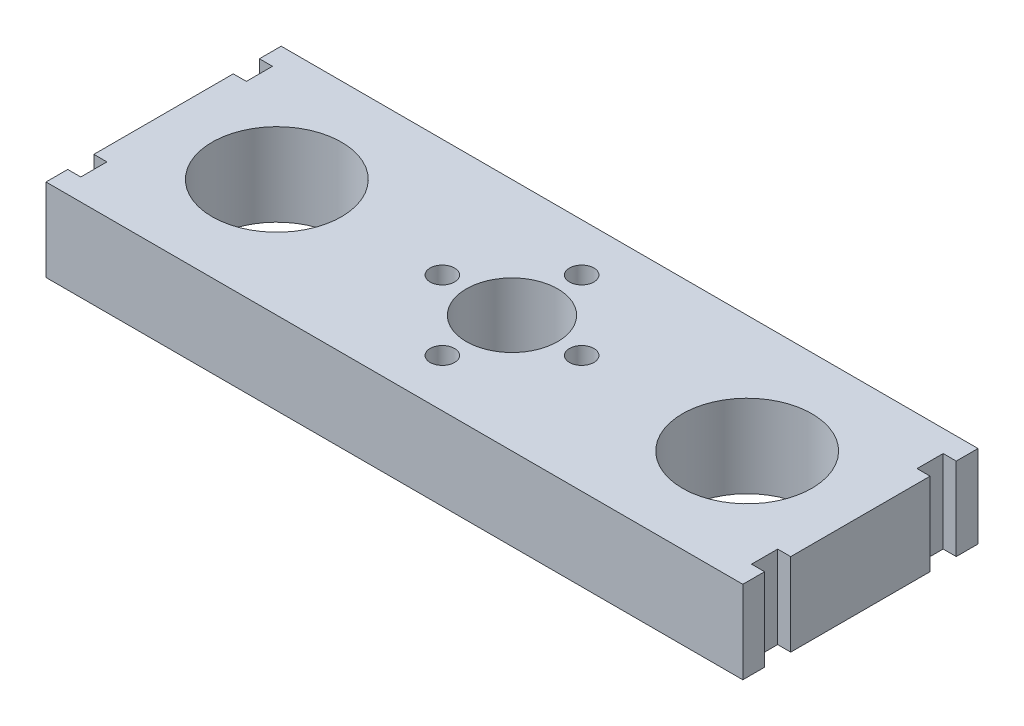
from build123d import *

# Parameters (mm, degrees)
SKETCH_1_W          = 80
SKETCH_1_H          = 27
EXTRUDE_1_DEPTH     = 9.5
SKETCH_3_R          = 7.425
CUT_EXTRUDE_1_DEPTH = 44.272393047
SKETCH_4_R          = 5.25
CUT_EXTRUDE_2_DEPTH = 44.272393047
SKETCH_5_R          = 1.4
CUT_EXTRUDE_3_DEPTH = 44.272393047
SKETCH_7_W          = 1.5
SKETCH_7_H          = 3
CUT_EXTRUDE_4_DEPTH = 44.272393047


with BuildPart() as part:
    # 草图1 → 凸台-拉伸1 (new body)
    with BuildSketch(Plane(origin=(0, 0, 0), x_dir=(1, 0, 0), z_dir=(0, 1, 0))):
        Rectangle(SKETCH_1_W, SKETCH_1_H)
    extrude(amount=EXTRUDE_1_DEPTH)

    # 草图3 → 切除-拉伸1 (cut, through all)
    with BuildSketch(Plane(origin=(0, 9.5, 0), x_dir=(1, 0, 0), z_dir=(0, 1, 0))):
        with Locations((-27, 0)):
            Circle(SKETCH_3_R)
        with Locations((27, 0)):
            Circle(SKETCH_3_R)
    extrude(amount=-CUT_EXTRUDE_1_DEPTH, mode=Mode.SUBTRACT)

    # 草图4 → 切除-拉伸2 (cut, through all)
    with BuildSketch(Plane(origin=(0, 9.5, 0), x_dir=(1, 0, 0), z_dir=(0, 1, 0))):
        Circle(SKETCH_4_R)
    extrude(amount=-CUT_EXTRUDE_2_DEPTH, mode=Mode.SUBTRACT)

    # 草图5 → 切除-拉伸3 (cut, through all)
    with BuildSketch(Plane(origin=(0, 9.5, 0), x_dir=(1, 0, 0), z_dir=(0, 1, 0))):
        with Locations((8, 0)):
            Circle(SKETCH_5_R)
        with Locations((-8, 0)):
            Circle(SKETCH_5_R)
        with Locations((0, 8)):
            Circle(SKETCH_5_R)
        with Locations((0, -8)):
            Circle(SKETCH_5_R)
    extrude(amount=-CUT_EXTRUDE_3_DEPTH, mode=Mode.SUBTRACT)

    # 草图7 → 切除-拉伸4 (cut, through all)
    with BuildSketch(Plane(origin=(0, 9.5, 0), x_dir=(1, 0, 0), z_dir=(0, 1, 0))):
        with Locations((39.25, 9.501563289)):
            Rectangle(SKETCH_7_W, SKETCH_7_H)
        with Locations((39.25, -9.49986112)):
            Rectangle(SKETCH_7_W, SKETCH_7_H)
        with Locations((-39.25, 9.501563289)):
            Rectangle(SKETCH_7_W, SKETCH_7_H)
        with Locations((-39.25, -9.506798333)):
            Rectangle(SKETCH_7_W, SKETCH_7_H)
    extrude(amount=-CUT_EXTRUDE_4_DEPTH, mode=Mode.SUBTRACT)


solid = part.part
